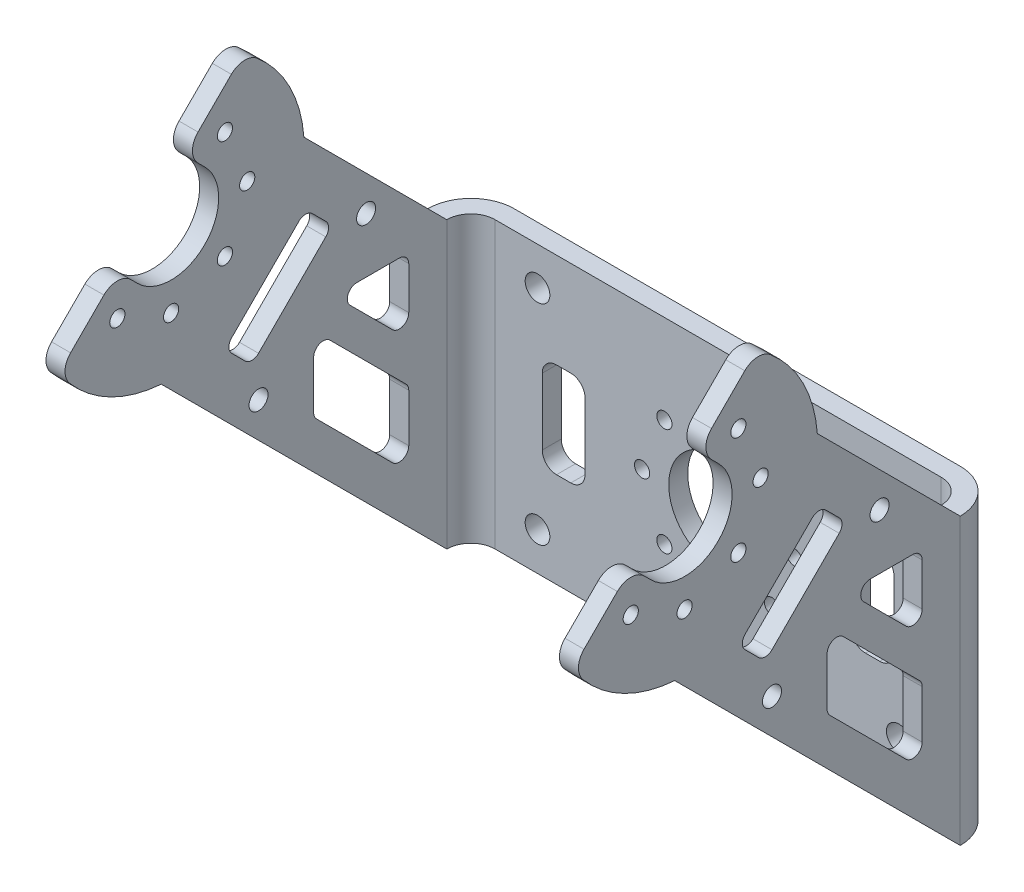
from build123d import *

# Parameters (mm, degrees)
KES_EKSTR_ZYON1_START          = -54
KES_EKSTR_ZYON1_OUTLINE_W      = 2
KES_EKSTR_ZYON1_OUTLINE_H      = 30
KES_EKSTR_ZYON1_DEPTH          = 56
KES_EKSTR_ZYON1_2_DEPTH        = 2
KES_EKSTR_ZYON1_3_DEPTH        = 2
KES_EKSTR_ZYON2_DEPTH          = 82.444892691
KES_EKSTR_ZYON3_DEPTH          = 82.444892691
KES_EKSTR_ZYON4_REACH          = 69.092
IZIM4_W                        = 4.5
IZIM4_H                        = 10
KES_EKSTR_ZYON5_DEPTH          = 82.444892691
KES_EKSTR_ZYON6_DEPTH          = 82.444892691
KES_EKSTR_ZYON7_DEPTH          = 82.444892691
KES_EKSTR_ZYON8_DEPTH          = 82.444892691
KES_EKSTR_ZYON9_DEPTH          = 82.444892691
KES_EKSTR_ZYON10_DEPTH         = 82.444892691
IZIM11_W                       = 4.5
IZIM11_H                       = 10
KES_EKSTR_ZYON11_DEPTH         = 66.75699783
DELIK1_D                       = 2.6
DELIK2_D                       = 10.4
F_0_2_0_2_DIAMETER_HOLE1_D     = 2
F_0_2_0_2_DIAMETER_HOLE1_DEPTH = 2
F_0_2_0_2_DIAMETER_HOLE2_D     = 2
RADYUS1_R                      = 1
RADYUS2_R                      = 1.5
RADYUS3_R                      = 2
RADYUS4_R                      = 2.54
RADYUS5_R                      = 4.54
IZIM24_R                       = 13.505605706
IZIM24_R_2                     = 7.578470051
Y_KSEKLIK_EKSTR_ZYON1_DEPTH    = 2
IZIM25_R                       = 0.8
KES_EKSTR_ZYON12_DEPTH         = 2
KES_EKSTR_ZYON13_REACH         = 84.134
IZIM27_R                       = 0.8


with BuildPart() as part:
    # Kes-Ekstrüzyon1: read off the stored shape, not the designer's step
    # Kes-Ekstrüzyon1 outline → Kes-Ekstrüzyon1 (new body)
    with BuildSketch(Plane(origin=(26, 0, 0), x_dir=(0, 0, -1), z_dir=(1, 0, 0)).offset(KES_EKSTR_ZYON1_START)):
        with Locations((-1, 0)):
            Rectangle(KES_EKSTR_ZYON1_OUTLINE_W, KES_EKSTR_ZYON1_OUTLINE_H)
    extrude(amount=KES_EKSTR_ZYON1_DEPTH)

    # Kes-Ekstr_zyon1 2 outline → Kes-Ekstr_zyon1 2 (add)
    with BuildSketch(Plane(origin=(26, 0, 0), x_dir=(0, 0, -1), z_dir=(1, 0, 0)).offset(KES_EKSTR_ZYON1_START)):
        with BuildLine():
            Line((-4.54, 15), (-19.569954037, 30.029954037))
            ThreePointArc((-19.569954037, 30.029954037), (-21.507688424, 36.162918334), (-25.983160829, 40.78224863))
            Line((-25.983160829, 40.78224863), (-45.321945481, 21.443463382))
            ThreePointArc((-45.321945481, 21.443463382), (-40.702951136, 16.968195195), (-34.570405924, 15.030406939))
            Line((-34.570405924, 15.030406939), (-4.54, -15))
            Line((-4.54, -15), (-2, -15))
            Line((-2, -15), (-2, 15))
            Line((-2, 15), (-4.54, 15))
        make_face()
    extrude(amount=KES_EKSTR_ZYON1_2_DEPTH)

    # Kes-Ekstr_zyon1 3 outline → Kes-Ekstr_zyon1 3 (add)
    with BuildSketch(Plane(origin=(26, 0, 0), x_dir=(0, 0, -1), z_dir=(1, 0, 0))):
        with BuildLine():
            Line((-4.54, 15), (-19.569954037, 30.029954037))
            ThreePointArc((-19.569954037, 30.029954037), (-21.507688424, 36.162918334), (-25.983160829, 40.78224863))
            Line((-25.983160829, 40.78224863), (-45.321945481, 21.443463382))
            ThreePointArc((-45.321945481, 21.443463382), (-40.702951136, 16.968195195), (-34.570405924, 15.030406939))
            Line((-34.570405924, 15.030406939), (-4.54, -15))
            Line((-4.54, -15), (-2, -15))
            Line((-2, -15), (-2, 15))
            Line((-2, 15), (-4.54, 15))
        make_face()
    extrude(amount=KES_EKSTR_ZYON1_3_DEPTH)

    # Çizim2 → Kes-Ekstrüzyon2 (cut, through all)
    with BuildSketch(Plane.ZY.offset(-26)):
        with BuildLine():
            Line((39.188241686, 27.577167772), (32.117166758, 34.648242701))
            Line((32.117166758, 34.648242701), (29.995846117, 32.52692206))
            ThreePointArc((29.995846117, 32.52692206), (29.995846117, 25.455847131), (37.066921045, 25.455847131))
            Line((37.066921045, 25.455847131), (39.188241686, 27.577167772))
        make_face()
    extrude(amount=-KES_EKSTR_ZYON2_DEPTH, mode=Mode.SUBTRACT)

    # Çizim3 → Kes-Ekstrüzyon3 (cut, through all)
    with BuildSketch(Plane(origin=(-26, 0, 0), x_dir=(0, 0, -1), z_dir=(1, 0, 0))):
        with BuildLine():
            Line((-32.11716646, 34.648242403), (-39.188241389, 27.577167475))
            Line((-39.188241389, 27.577167475), (-37.066921045, 25.455847131))
            ThreePointArc((-37.066921045, 25.455847131), (-29.995846117, 25.455847131), (-29.995846117, 32.52692206))
            Line((-29.995846117, 32.52692206), (-32.11716646, 34.648242403))
        make_face()
    extrude(amount=-KES_EKSTR_ZYON3_DEPTH, mode=Mode.SUBTRACT)

    # Çizim4 → Kes-Ekstrüzyon4 (cut, up to next)
    with BuildSketch(Plane(origin=(0, 0, 0), x_dir=(-1, 0, 0), z_dir=(0, 0, -1)), mode=Mode.PRIVATE) as kes_ekstr_zyon4_sk1:
        with Locations((16.25, 0)):
            Rectangle(IZIM4_W, IZIM4_H)
    kes_ekstr_zyon4_tool1 = extrude(kes_ekstr_zyon4_sk1.sketch, amount=-KES_EKSTR_ZYON4_REACH, mode=Mode.PRIVATE) & part.part
    add(kes_ekstr_zyon4_tool1.solids().sort_by_distance((-16.25, 0, 0))[0], mode=Mode.SUBTRACT)

    # Çizim5 → Kes-Ekstrüzyon5 (cut, through all)
    with BuildSketch(Plane.ZY.offset(-26)):
        with BuildLine():
            Line((10.247106781, 7.828427125), (14.711572875, 12.292893219))
            ThreePointArc((14.711572875, 12.292893219), (14.928345627, 13.382683432), (14.004466094, 14))
            Line((14.004466094, 14), (8.54, 14))
            Line((8.54, 14), (8.54, 8.535533906))
            ThreePointArc((8.54, 8.535533906), (9.157316568, 7.611654373), (10.247106781, 7.828427125))
        make_face()
    extrude(amount=-KES_EKSTR_ZYON5_DEPTH, mode=Mode.SUBTRACT)

    # Çizim6 → Kes-Ekstrüzyon6 (cut, through all)
    with BuildSketch(Plane.ZY.offset(-26)):
        Polygon((27.874529335, 14.849248859), (19.389247817, 23.334530089), (16.56082074, 20.506102917), (25.046102258, 12.020821686), align=None)
    extrude(amount=-KES_EKSTR_ZYON6_DEPTH, mode=Mode.SUBTRACT)

    # Çizim7 → Kes-Ekstrüzyon7 (cut, through all)
    with BuildSketch(Plane.ZY.offset(-26)):
        with BuildLine():
            Line((16.832893122, 10.171572778), (8.54, 1.878679656))
            Line((8.54, 1.878679656), (8.54, -3.585786438))
            ThreePointArc((8.54, -3.585786438), (9.157316575, -4.509665973), (10.247106793, -4.292893207))
            Line((10.247106793, -4.292893207), (18.539999854, 4.000000134))
            Line((18.539999854, 4.000000134), (18.539999854, 9.464466017))
            ThreePointArc((18.539999854, 9.464466017), (17.922683304, 10.388345523), (16.832893122, 10.171572778))
        make_face()
    extrude(amount=-KES_EKSTR_ZYON7_DEPTH, mode=Mode.SUBTRACT)

    # Çizim8 → Kes-Ekstrüzyon8 (cut, through all)
    with BuildSketch(Plane(origin=(-26, 0, 0), x_dir=(0, 0, -1), z_dir=(1, 0, 0))):
        with BuildLine():
            Line((-8.54, 8.535533906), (-8.54, 14))
            Line((-8.54, 14), (-14.004466094, 14))
            ThreePointArc((-14.004466094, 14), (-14.928345627, 13.382683432), (-14.711572875, 12.292893219))
            Line((-14.711572875, 12.292893219), (-10.247106781, 7.828427125))
            ThreePointArc((-10.247106781, 7.828427125), (-9.157316568, 7.611654373), (-8.54, 8.535533906))
        make_face()
    extrude(amount=-KES_EKSTR_ZYON8_DEPTH, mode=Mode.SUBTRACT)

    # Çizim9 → Kes-Ekstrüzyon9 (cut, through all)
    with BuildSketch(Plane(origin=(-26, 0, 0), x_dir=(0, 0, -1), z_dir=(1, 0, 0))):
        Polygon((-19.389247817, 23.334530089), (-27.874529335, 14.849248859), (-25.046102258, 12.020821686), (-16.56082074, 20.506102917), align=None)
    extrude(amount=-KES_EKSTR_ZYON9_DEPTH, mode=Mode.SUBTRACT)

    # Çizim10 → Kes-Ekstrüzyon10 (cut, through all)
    with BuildSketch(Plane(origin=(-26, 0, 0), x_dir=(0, 0, -1), z_dir=(1, 0, 0))):
        with BuildLine():
            Line((-18.539999854, 9.46446608), (-18.539999854, 4.000000134))
            Line((-18.539999854, 4.000000134), (-10.247106757, -4.292893243))
            ThreePointArc((-10.247106757, -4.292893243), (-9.157316576, -4.509666002), (-8.540000021, -3.585786497))
            Line((-8.540000021, -3.585786497), (-8.540000021, 1.878679489))
            Line((-8.540000021, 1.878679489), (-16.83289312, 10.171572827))
            ThreePointArc((-16.83289312, 10.171572827), (-17.9226833, 10.388345584), (-18.539999854, 9.46446608))
        make_face()
    extrude(amount=-KES_EKSTR_ZYON10_DEPTH, mode=Mode.SUBTRACT)

    # Çizim11 → Kes-Ekstrüzyon11 (cut, through all)
    with BuildSketch(Plane.XY.offset(2)):
        with Locations((16.25, 0)):
            Rectangle(IZIM11_W, IZIM11_H)
    extrude(amount=-KES_EKSTR_ZYON11_DEPTH, mode=Mode.SUBTRACT)

    # Delik1 (through all)
    with Locations(Plane.XY.offset(2)):
        with Locations((-19, 11), (19, 11), (-19, -11), (19, -11), (7.778174593, 7.778174593), (11, 0), (7.778174593, -7.778174593), (0, -11), (-7.778174593, -7.778174593), (-11, 0), (-7.778174593, 7.778174593), (0, 11)):
            Hole(DELIK1_D / 2)

    # Delik2 (through all)
    with Locations(Plane.XY.offset(2)):
        with Locations((0, 0)):
            Hole(DELIK2_D / 2)

    # Ø0.2 (0.2) Diameter Hole1
    with Locations(Plane.ZY.offset(28)):
        with Locations((24.338989873, 8.485281374), (13.025281374, 19.798989873)):
            Hole(F_0_2_0_2_DIAMETER_HOLE1_D / 2, depth=F_0_2_0_2_DIAMETER_HOLE1_DEPTH)

    # Ø0.2 (0.2) Diameter Hole2 (through all)
    with Locations(Plane.ZY.offset(-26)):
        with Locations((24.338989873, 8.485281374), (13.025281374, 19.798989873)):
            Hole(F_0_2_0_2_DIAMETER_HOLE2_D / 2)

    # Radyus1
    radyus1_edges = [part.edges().sort_by_distance(p)[0] for p in [
        (27, 14, 8.54),
        (27, 14.849248859, 27.874529335),
        (27, 12.020821686, 25.046102258),
        (27, 20.506102917, 16.56082074),
        (27, 23.334530089, 19.389247817),
        (27, 4.000000134, 18.539999854),
        (27, 1.878679656, 8.54),
        (-27, 14, 8.54),
        (-27, 23.334530089, 19.389247817),
        (-27, 20.506102917, 16.56082074),
        (-27, 12.020821686, 25.046102258),
        (-27, 14.849248859, 27.874529335),
        (-27, 1.878679489, 8.540000021),
        (-27, 4.000000134, 18.539999854),
    ]]
    fillet(radyus1_edges, radius=RADYUS1_R)

    # Radyus2
    radyus2_edges = [part.edges().sort_by_distance(p)[0] for p in [
        (-14, 5, 1),
        (-18.5, 5, 1),
        (-18.5, -5, 1),
        (-14, -5, 1),
        (18.5, -5, 1),
        (14, -5, 1),
        (14, 5, 1),
        (18.5, 5, 1),
    ]]
    fillet(radyus2_edges, radius=RADYUS2_R)

    # Radyus3
    radyus3_edges = [part.edges().sort_by_distance(p)[0] for p in [
        (27, 21.443463382, 45.321945481),
        (-27, 40.78224863, 25.983160829),
        (-27, 21.443463382, 45.321945481),
        (27, 40.78224863, 25.983160829),
        (27, 27.577167772, 39.188241686),
        (27, 34.648242701, 32.117166758),
        (-27, 34.648242403, 32.11716646),
        (-27, 27.577167475, 39.188241389),
    ]]
    fillet(radyus3_edges, radius=RADYUS3_R)

    # Radyus4
    radyus4_edges = [part.edges().sort_by_distance(p)[0] for p in [
        (-26, 0, 2),
        (26, 0, 2),
    ]]
    fillet(radyus4_edges, radius=RADYUS4_R)

    # Radyus5
    radyus5_edges = [part.edges().sort_by_distance(p)[0] for p in [
        (-28, 0, 0),
        (28, 0, 0),
    ]]
    fillet(radyus5_edges, radius=RADYUS5_R)

    # Çizim24 → Yükseklik-Ekstrüzyon1 (add)
    with BuildSketch(Plane.XY.offset(2)):
        Circle(IZIM24_R)
        Circle(IZIM24_R_2, mode=Mode.SUBTRACT)
    extrude(amount=-Y_KSEKLIK_EKSTR_ZYON1_DEPTH)

    # Çizim25 → Kes-Ekstrüzyon12 (cut)
    with BuildSketch(Plane.XY.offset(2)):
        with Locations((0, 8)):
            Circle(IZIM25_R)
        with Locations((5.656854249, 5.656854249)):
            Circle(IZIM25_R)
        with Locations((8, 0)):
            Circle(IZIM25_R)
        with Locations((5.656854249, -5.656854249)):
            Circle(IZIM25_R)
        with Locations((0, -8)):
            Circle(IZIM25_R)
        with Locations((-5.656854249, -5.656854249)):
            Circle(IZIM25_R)
        with Locations((-8, 0)):
            Circle(IZIM25_R)
        with Locations((-5.656854249, 5.656854249)):
            Circle(IZIM25_R)
    extrude(amount=-KES_EKSTR_ZYON12_DEPTH, mode=Mode.SUBTRACT)

    # Kes-Ekstrüzyon13: up to this face of the body (flat: up to its plane)
    kes_ekstr_zyon13_end = Plane(part.part.faces().sort_by_distance((28, 15.486105726, 21.072998549))[0])
    # Çizim27 → Kes-Ekstrüzyon13 (cut, up to the picked face)
    with BuildSketch(Plane.ZY.offset(28), mode=Mode.PRIVATE) as kes_ekstr_zyon13_sk1:
        with Locations((39.18823783, 23.334530346)):
            Circle(IZIM27_R)
    kes_ekstr_zyon13_tool1 = split(extrude(kes_ekstr_zyon13_sk1.sketch, amount=-KES_EKSTR_ZYON13_REACH, mode=Mode.PRIVATE), bisect_by=kes_ekstr_zyon13_end, keep=Keep.BOTH, mode=Mode.PRIVATE)
    # Çizim27 → Kes-Ekstrüzyon13 (cut, up to the picked face)
    with BuildSketch(Plane.ZY.offset(28), mode=Mode.PRIVATE) as kes_ekstr_zyon13_sk2:
        with Locations((33.531383581, 20.991384595)):
            Circle(IZIM27_R)
    kes_ekstr_zyon13_tool2 = split(extrude(kes_ekstr_zyon13_sk2.sketch, amount=-KES_EKSTR_ZYON13_REACH, mode=Mode.PRIVATE), bisect_by=kes_ekstr_zyon13_end, keep=Keep.BOTH, mode=Mode.PRIVATE)
    # Çizim27 → Kes-Ekstrüzyon13 (cut, up to the picked face)
    with BuildSketch(Plane.ZY.offset(28), mode=Mode.PRIVATE) as kes_ekstr_zyon13_sk3:
        with Locations((27.874529331, 23.334530346)):
            Circle(IZIM27_R)
    kes_ekstr_zyon13_tool3 = split(extrude(kes_ekstr_zyon13_sk3.sketch, amount=-KES_EKSTR_ZYON13_REACH, mode=Mode.PRIVATE), bisect_by=kes_ekstr_zyon13_end, keep=Keep.BOTH, mode=Mode.PRIVATE)
    # Çizim27 → Kes-Ekstrüzyon13 (cut, up to the picked face)
    with BuildSketch(Plane.ZY.offset(28), mode=Mode.PRIVATE) as kes_ekstr_zyon13_sk4:
        with Locations((25.531383581, 28.991384595)):
            Circle(IZIM27_R)
    kes_ekstr_zyon13_tool4 = split(extrude(kes_ekstr_zyon13_sk4.sketch, amount=-KES_EKSTR_ZYON13_REACH, mode=Mode.PRIVATE), bisect_by=kes_ekstr_zyon13_end, keep=Keep.BOTH, mode=Mode.PRIVATE)
    # Çizim27 → Kes-Ekstrüzyon13 (cut, up to the picked face)
    with BuildSketch(Plane.ZY.offset(28), mode=Mode.PRIVATE) as kes_ekstr_zyon13_sk5:
        with Locations((27.874529331, 34.648238845)):
            Circle(IZIM27_R)
    kes_ekstr_zyon13_tool5 = split(extrude(kes_ekstr_zyon13_sk5.sketch, amount=-KES_EKSTR_ZYON13_REACH, mode=Mode.PRIVATE), bisect_by=kes_ekstr_zyon13_end, keep=Keep.BOTH, mode=Mode.PRIVATE)
    add(kes_ekstr_zyon13_tool1.solids().sort_by(Axis((-28, 23.33453, 39.188238), (1, 0, 0)))[0], mode=Mode.SUBTRACT)
    add(kes_ekstr_zyon13_tool2.solids().sort_by(Axis((-28, 20.991385, 33.531384), (1, 0, 0)))[0], mode=Mode.SUBTRACT)
    add(kes_ekstr_zyon13_tool3.solids().sort_by(Axis((-28, 23.33453, 27.874529), (1, 0, 0)))[0], mode=Mode.SUBTRACT)
    add(kes_ekstr_zyon13_tool4.solids().sort_by(Axis((-28, 28.991385, 25.531384), (1, 0, 0)))[0], mode=Mode.SUBTRACT)
    add(kes_ekstr_zyon13_tool5.solids().sort_by(Axis((-28, 34.648239, 27.874529), (1, 0, 0)))[0], mode=Mode.SUBTRACT)


solid = part.part
